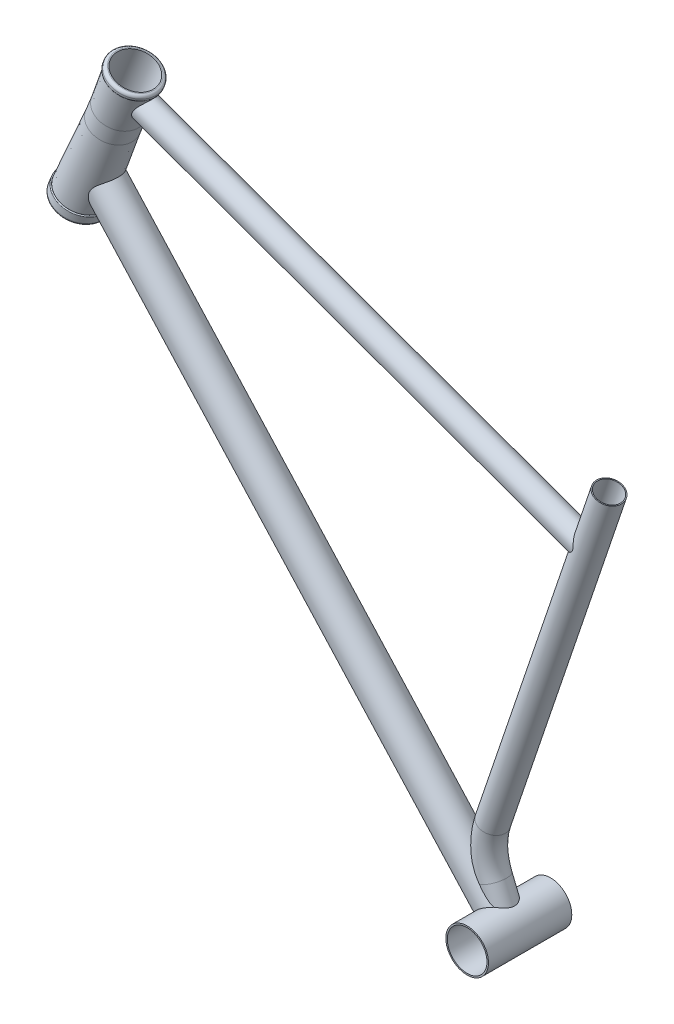
from build123d import *

# Parameters (mm, degrees)
SKETCH4_R                       = 22
SKETCH4_R_2                     = 20.475
BOSS_EXTRUDE1_DEPTH             = 43
BOSS_EXTRUDE2_REACH             = 748.809
BOSS_EXTRUDE2_END_RADIUS        = 22
BOSS_EXTRUDE2_START             = -80
SKETCH5_R                       = 17.5
SKETCH5_R_2                     = 16.12
BOSS_EXTRUDE2_DIRECTION_2_REACH = 748.809
SWEEP_THIN1_PROFILE_R           = 13.5
SWEEP_THIN1_PROFILE_R_2         = 12.5
CUT_EXTRUDE1_DEPTH              = 637.867182136
CUT_EXTRUDE1_DEPTH_BACK         = 637.867182136
SKETCH41_R                      = 20.475
BOSS_EXTRUDE3_REACH             = 840.755
BOSS_EXTRUDE3_START             = -70
SKETCH7_R                       = 12.5
SKETCH7_R_2                     = 11.5
BOSS_EXTRUDE3_DIRECTION_2_REACH = 840.755


with BuildPart() as part:
    # Sketch2 → Revolve1 (revolve)
    with BuildSketch(Plane.XY):
        with BuildLine():
            Line((-116.983720572, 292.697695192), (-118.838088281, 293.446908379))
            ThreePointArc((-118.838088281, 293.446908379), (-120.475783061, 295.056266557), (-120.495820065, 297.352279723))
            Line((-120.495820065, 297.352279723), (-117.573888636, 304.584313788))
            ThreePointArc((-117.573888636, 304.584313788), (-117.03743591, 305.130212048), (-116.272098188, 305.13689105))
            Line((-116.272098188, 305.13689105), (-116.222765991, 305.116959548))
            Line((-116.222765991, 305.116959548), (-83.45348683, 379.692136663))
            Line((-83.45348683, 379.692136663), (-77.19155313, 395.190966442))
            Line((-77.19155313, 395.190966442), (-63.90247365, 431.915965465))
            Line((-63.90247365, 431.915965465), (-63.990669821, 431.954968036))
            ThreePointArc((-63.990669821, 431.954968036), (-64.512940006, 432.493761646), (-64.513410753, 433.24413787))
            Line((-64.513410753, 433.24413787), (-63.752253791, 435.12806746))
            ThreePointArc((-63.752253791, 435.12806746), (-62.142895613, 436.76576224), (-59.846882447, 436.785799243))
            Line((-59.846882447, 436.785799243), (-58.919698593, 436.41119265))
            Line((-58.919698593, 436.41119265), (-116.983720572, 292.697695192))
        make_face()
    revolve(axis=Axis((67.310014772, 695.451353458, 0), (-0.37460659341590935, -0.9271838545667885, 0)))



with BuildPart() as body_2:
    # Sketch4 → Boss-Extrude1 (new, symmetric)
    with BuildSketch(Plane.XY):
        with Locations((345.080301407, -143.302304808)):
            Circle(SKETCH4_R)
        with Locations((345.080301407, -143.302304808)):
            Circle(SKETCH4_R_2, mode=Mode.SUBTRACT)
    extrude(amount=BOSS_EXTRUDE1_DEPTH, both=True)


with BuildPart() as part_1:
    add(part.part)

    add(body_2.part)  # Boss-Extrude2 merges body 2
    # Boss-Extrude2: up to this cylinder (the profile starts outside it)
    boss_extrude2_end = Plane(origin=(345.080301407, -143.302304808, 0), z_dir=(0, 0, -1)) * Cylinder(BOSS_EXTRUDE2_END_RADIUS, 1542.618, mode=Mode.PRIVATE)
    # Sketch5 → Boss-Extrude2 (add, up to the surface)
    with BuildSketch(Plane(origin=(-82.10688307, 325.631553931, 0), x_dir=(0.7392463003117191, 0.6734351546180491, 0), z_dir=(-0.6734351546180491, 0.7392463003117191, 0)).offset(BOSS_EXTRUDE2_START), mode=Mode.PRIVATE) as boss_extrude2_sk1:
        with Locations(Location((0, 0, 0), (0, 0, 180))):
            Circle(SKETCH5_R)
        with Locations(Location((0, 0, 0), (0, 0, 180))):
            Circle(SKETCH5_R_2, mode=Mode.SUBTRACT)
    boss_extrude2_tool1 = extrude(boss_extrude2_sk1.sketch, amount=-BOSS_EXTRUDE2_REACH, mode=Mode.PRIVATE) - boss_extrude2_end
    add(boss_extrude2_tool1.solids().sort_by_distance((-15.661169, 277.943632, 0))[0])

    # Boss-Extrude2 direction 2: up to this cone (the profile starts outside it)
    boss_extrude2_direction_2_end = Plane(origin=(-89.345956451, 307.714218575, 0), z_dir=(-0.3746065934159094, -0.9271838545667885, 0)) * Cone(0.345768587, 46.797955747, 1545.761724334, mode=Mode.PRIVATE)
    # Sketch5 → Boss-Extrude2 direction 2 (add, up to the surface)
    with BuildSketch(Plane(origin=(-82.10688307, 325.631553931, 0), x_dir=(0.7392463003117191, 0.6734351546180491, 0), z_dir=(-0.6734351546180491, 0.7392463003117191, 0)).offset(BOSS_EXTRUDE2_START), mode=Mode.PRIVATE) as boss_extrude2_direction_2_sk1:
        with Locations(Location((0, 0, 0), (0, 0, 180))):
            Circle(SKETCH5_R)
        with Locations(Location((0, 0, 0), (0, 0, 180))):
            Circle(SKETCH5_R_2, mode=Mode.SUBTRACT)
    boss_extrude2_direction_2_tool1 = extrude(boss_extrude2_direction_2_sk1.sketch, amount=BOSS_EXTRUDE2_DIRECTION_2_REACH, mode=Mode.PRIVATE) - boss_extrude2_direction_2_end
    add(boss_extrude2_direction_2_tool1.solids().sort_by_distance((-15.661169, 277.943632, 0))[0])

    # Sweep-Thin1: sweep along a path in Sketch29
    with BuildLine(Plane.XY) as sweep_thin1_path:
        Line((448.49142207, 296.697695192), (328.555978305, -57.63630978))
        ThreePointArc((328.555978305, -57.63630978), (324.893928625, -82.235887538), (330.064110253, -106.563218991))
        Line((330.064110253, -106.563218991), (345.080301407, -143.302304808))
    # Sweep-Thin1 profile (on start of the path) → Sweep-Thin1 (sweep)
    with BuildSketch(Plane(origin=(448.49142207, 296.697695192, 0), x_dir=(-0.9472102777460297, 0.3206129905856736, 0), z_dir=(-0.3206129905856736, -0.9472102777460297, 0))):
        Circle(SWEEP_THIN1_PROFILE_R)
        Circle(SWEEP_THIN1_PROFILE_R_2, mode=Mode.SUBTRACT)
    sweep(path=sweep_thin1_path.line)

    # Sketch41 → Cut-Extrude1 (cut, two sides: drawn at the far end of the back side and taken through both)
    with BuildSketch(Plane.XY.offset(-CUT_EXTRUDE1_DEPTH_BACK)):
        with Locations((345.080301407, -143.302304808)):
            Circle(SKETCH41_R)
    extrude(amount=CUT_EXTRUDE1_DEPTH + CUT_EXTRUDE1_DEPTH_BACK, mode=Mode.SUBTRACT)

    # Sketch7 → Boss-Extrude3 (add, up to next)
    with BuildSketch(Plane(origin=(-48.689985228, 408.341278461, 0), x_dir=(0, 0, 1), z_dir=(-0.9404222215262605, 0.3400088899714431, 0)).offset(BOSS_EXTRUDE3_START), mode=Mode.PRIVATE) as boss_extrude3_sk1:
        with Locations(Location((0, 0.416409776, 0), (0, 0, 270))):
            Circle(SKETCH7_R)
        with Locations(Location((0, 0.416409776, 0), (0, 0, 270))):
            Circle(SKETCH7_R_2, mode=Mode.SUBTRACT)
    boss_extrude3_tool1 = extrude(boss_extrude3_sk1.sketch, amount=-BOSS_EXTRUDE3_REACH, mode=Mode.PRIVATE) - part_1.part
    add(boss_extrude3_tool1.solids().sort_by_distance((21.411053, 396.355045, 0))[0])

    # Sketch7 → Boss-Extrude3 direction 2 (add, up to next)
    with BuildSketch(Plane(origin=(-48.689985228, 408.341278461, 0), x_dir=(0, 0, 1), z_dir=(-0.9404222215262605, 0.3400088899714431, 0)).offset(BOSS_EXTRUDE3_START), mode=Mode.PRIVATE) as boss_extrude3_direction_2_sk1:
        with Locations(Location((0, 0.416409776, 0), (0, 0, 270))):
            Circle(SKETCH7_R)
        with Locations(Location((0, 0.416409776, 0), (0, 0, 270))):
            Circle(SKETCH7_R_2, mode=Mode.SUBTRACT)
    boss_extrude3_direction_2_tool1 = extrude(boss_extrude3_direction_2_sk1.sketch, amount=BOSS_EXTRUDE3_DIRECTION_2_REACH, mode=Mode.PRIVATE) - part_1.part
    add(boss_extrude3_direction_2_tool1.solids().sort_by_distance((21.411053, 396.355045, 0))[0])


solid = part_1.part
